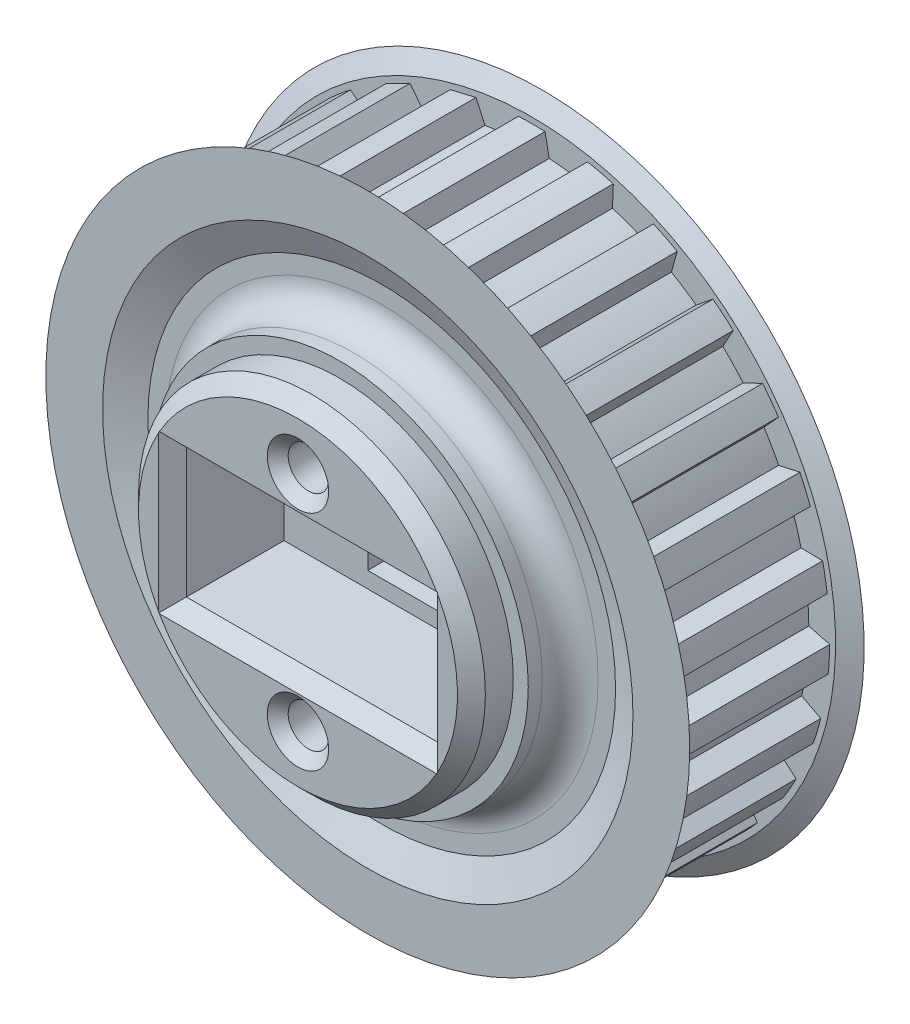
from build123d import *
from OCP.BRepFilletAPI import BRepFilletAPI_MakeChamfer
from build123d.topology import SkipClean

# Parameters (mm, degrees)
CROQUIS1_R                 = 1.5
SALIENTE_EXTRUIR1_DEPTH    = 11
CROQUIS2_R                 = 23.5
CROQUIS2_R_2               = 1.5
SALIENTE_EXTRUIR2_DEPTH    = 0.75
SALIENTE_EXTRUIR4_START    = 5.5
CROQUIS4_R                 = 12.35
CROQUIS4_R_2               = 1.5
SALIENTE_EXTRUIR4_DEPTH    = 5.5
SALIENTE_EXTRUIR6_START    = 0.75
CROQUIS6_R                 = 23.5
CROQUIS6_R_2               = 1.5
SALIENTE_EXTRUIR6_DEPTH    = 0.75
SKETCH6_R                  = 18.5
SKETCH6_R_2                = 12.35
CUT_EXTRUDE3_DEPTH         = 1
SALIENTE_EXTRUIR5_START    = 2.75
CROQUIS5_R                 = 13.5
CROQUIS5_R_2               = 1.5
SALIENTE_EXTRUIR5_DEPTH    = 2.75
CHAFL_N2_SIZE              = 1.732050808
CHAFL_N2_SIZE_2            = 1
CROQUIS3_R                 = 12.425
CROQUIS3_R_2               = 1.5
SALIENTE_EXTRUIR7_DEPTH    = 5
CUT_EXTRUDE4_START         = -1
SKETCH7_R                  = 19
SKETCH7_R_2                = 12.425
CUT_EXTRUDE4_DEPTH         = 1
CHAFL_N4_SIZE              = 1
CROQUIS7_R                 = 13.5
CROQUIS7_R_2               = 1.5
SALIENTE_EXTRUIR8_DEPTH    = 3
CORTAR_EXTRUIR1_DEPTH      = 37.670619111
CORTAR_EXTRUIR1_DEPTH_BACK = 37.670619111
CROQUIS8_R                 = 1.45
CROQUIS8_W                 = 6
CROQUIS8_H                 = 7
CROQUIS10_W                = 18
CROQUIS10_H                = 9.3
CORTAR_EXTRUIR3_DEPTH      = 8
CHAFL_N5_SIZE              = 1
SKETCH1_R                  = 12.35
SKETCH1_R_2                = 1.45
BOSS_EXTRUDE1_DEPTH        = 5
SKETCH2_R                  = 1.45
CUT_EXTRUDE1_DEPTH         = 40.487141021
SKETCH4_W                  = 6
SKETCH4_H                  = 7
CUT_EXTRUDE2_DEPTH         = 30
CHAMFER3_SIZE              = 1.25
CHAMFER2_SIZE              = 0.75
CHAMFER4_SIZE              = 1
CHAMFER4_SIZE_2            = 2.246036774
CHAMFER5_SIZE              = 0.75
FILLET1_R                  = 2
CHAMFER6_SIZE              = 1.2


# Some blends are built 0.0001 mm under size
with BuildPart() as part:
    # Croquis1 → Saliente-Extruir1 (new body)
    with BuildSketch(Plane.XY):
        with BuildLine():
            Line((-0.95, 21.328853696), (-1.25, 19.810603222))
            ThreePointArc((-1.25, 19.810603222), (-2.304444345, 19.715781401), (-3.352333424, 19.564875686))
            Line((-3.352333424, 19.564875686), (-3.99437954, 20.973016762))
            Line((-3.99437954, 20.973016762), (-5.843164794, 20.534846607))
            Line((-5.843164794, 20.534846607), (-5.7849456, 18.988336009))
            ThreePointArc((-5.7849456, 18.988336009), (-6.789099845, 18.652898523), (-7.773941685, 18.264400638))
            Line((-7.773941685, 18.264400638), (-8.723421045, 19.486519065))
            Line((-8.723421045, 19.486519065), (-10.421323062, 18.633800623))
            Line((-10.421323062, 18.633800623), (-10.008023285, 17.142402688))
            ThreePointArc((-10.008023285, 17.142402688), (-10.907753215, 16.584433057), (-11.776454737, 15.979287025))
            Line((-11.776454737, 15.979287025), (-12.982180664, 16.949498081))
            ThreePointArc((-12.982180664, 16.949498081), (-13.723515467, 16.355048861), (-14.437665106, 15.728201623))
            Line((-14.437665106, 15.728201623), (-13.691565845, 14.372318001))
            ThreePointArc((-13.691565845, 14.372318001), (-14.438366785, 13.621896512), (-15.144096067, 12.832725911))
            Line((-15.144096067, 12.832725911), (-16.541067563, 13.498725269))
            ThreePointArc((-16.541067563, 13.498725269), (-17.125330165, 12.749335933), (-17.675668887, 11.974691203))
            Line((-17.675668887, 11.974691203), (-16.636992546, 10.82741793))
            ThreePointArc((-16.636992546, 10.82741793), (-17.190604265, 9.925), (-17.695315257, 8.994349223))
            Line((-17.695315257, 8.994349223), (-19.208221228, 9.320232683))
            ThreePointArc((-19.208221228, 9.320232683), (-19.603913882, 8.456303005), (-19.960772783, 7.57562208))
            Line((-19.960772783, 7.57562208), (-18.685514673, 6.698808955))
            ThreePointArc((-18.685514673, 6.698808955), (-19.016091819, 5.693044169), (-19.292575422, 4.671084839))
            Line((-19.292575422, 4.671084839), (-20.839854714, 4.639283941))
            ThreePointArc((-20.839854714, 4.639283941), (-21.025645527, 3.707388593), (-21.169786252, 2.768149211))
            Line((-21.169786252, 2.768149211), (-19.726695866, 2.209065457))
            ThreePointArc((-19.726695866, 2.209065457), (-19.816416942, 1.154174854), (-19.849767852, 0.096001063))
            Line((-19.849767852, 0.096001063), (-21.348006239, -0.291769799))
            ThreePointArc((-21.348006239, -0.291769799), (-21.313879179, -1.241392097), (-21.237531064, -2.188555299))
            Line((-21.237531064, -2.188555299), (-19.70440578, -2.399769333))
            ThreePointArc((-19.70440578, -2.399769333), (-19.548433897, -3.446916327), (-19.33685416, -4.484258155))
            Line((-19.33685416, -4.484258155), (-20.705281222, -5.207094153))
            ThreePointArc((-20.705281222, -5.207094153), (-20.453076088, -6.123249018), (-20.16035508, -7.027274227))
            Line((-20.16035508, -7.027274227), (-18.619846078, -6.879231936))
            ThreePointArc((-18.619846078, -6.879231936), (-18.226589722, -7.862183356), (-17.781485654, -8.822769856))
            Line((-17.781485654, -8.822769856), (-18.946329135, -9.841702715))
            ThreePointArc((-18.946329135, -9.841702715), (-18.489642371, -10.675), (-17.996329135, -11.487150982))
            Line((-17.996329135, -11.487150982), (-16.531485654, -10.987833365))
            ThreePointArc((-16.531485654, -10.987833365), (-15.922145376, -11.853598045), (-15.267512654, -12.68564375))
            Line((-15.267512654, -12.68564375), (-16.16597554, -13.945742535))
            ThreePointArc((-16.16597554, -13.945742535), (-15.529427248, -14.651258968), (-14.862116428, -15.327752454))
            Line((-14.862116428, -15.327752454), (-13.55190856, -14.504077854))
            ThreePointArc((-13.55190856, -14.504077854), (-12.759334052, -15.205982196), (-11.930464095, -15.864631306))
            Line((-11.930464095, -15.864631306), (-12.514110019, -17.297963766))
            ThreePointArc((-12.514110019, -17.297963766), (-11.732016682, -17.837664774), (-10.926683177, -18.342030824))
            Line((-10.926683177, -18.342030824), (-9.841744567, -17.238403751))
            ThreePointArc((-9.841744567, -17.238403751), (-8.908663727, -17.73860791), (-7.950241129, -18.188352481))
            Line((-7.950241129, -18.188352481), (-8.187605588, -19.717647292))
            ThreePointArc((-8.187605588, -19.717647292), (-7.30213006, -20.062437454), (-6.402189608, -20.367485564))
            Line((-6.402189608, -20.367485564), (-5.601009577, -19.04340284))
            ThreePointArc((-5.601009577, -19.04340284), (-4.577725034, -19.314940681), (-3.541418606, -19.531534867))
            Line((-3.541418606, -19.531534867), (-3.41970522, -21.074347349))
            ThreePointArc((-3.41970522, -21.074347349), (-2.478583717, -21.205638938), (-1.532552341, -21.294923886))
            Line((-1.532552341, -21.294923886), (-1.058322711, -19.821767152))
            ThreePointArc((-1.058322711, -19.821767152), (0, -19.85), (1.058322711, -19.821767152))
            Line((1.058322711, -19.821767152), (1.532552341, -21.294923886))
            ThreePointArc((1.532552341, -21.294923886), (2.478583717, -21.205638938), (3.41970522, -21.074347349))
            Line((3.41970522, -21.074347349), (3.541418606, -19.531534867))
            ThreePointArc((3.541418606, -19.531534867), (4.577725034, -19.314940681), (5.601009577, -19.04340284))
            Line((5.601009577, -19.04340284), (6.402189608, -20.367485564))
            ThreePointArc((6.402189608, -20.367485564), (7.30213006, -20.062437454), (8.187605588, -19.717647292))
            Line((8.187605588, -19.717647292), (7.950241129, -18.188352481))
            ThreePointArc((7.950241129, -18.188352481), (8.908663727, -17.73860791), (9.841744567, -17.238403751))
            Line((9.841744567, -17.238403751), (10.926683177, -18.342030824))
            ThreePointArc((10.926683177, -18.342030824), (11.732016682, -17.837664774), (12.514110019, -17.297963766))
            Line((12.514110019, -17.297963766), (11.930464095, -15.864631306))
            ThreePointArc((11.930464095, -15.864631306), (12.759334052, -15.205982196), (13.55190856, -14.504077854))
            Line((13.55190856, -14.504077854), (14.862116428, -15.327752454))
            ThreePointArc((14.862116428, -15.327752454), (15.529427248, -14.651258968), (16.16597554, -13.945742535))
            Line((16.16597554, -13.945742535), (15.267512654, -12.68564375))
            ThreePointArc((15.267512654, -12.68564375), (15.922145376, -11.853598045), (16.531485654, -10.987833365))
            Line((16.531485654, -10.987833365), (17.996329135, -11.487150982))
            ThreePointArc((17.996329135, -11.487150982), (18.489642371, -10.675), (18.946329135, -9.841702715))
            Line((18.946329135, -9.841702715), (17.781485654, -8.822769856))
            ThreePointArc((17.781485654, -8.822769856), (18.226589722, -7.862183356), (18.619846078, -6.879231936))
            Line((18.619846078, -6.879231936), (20.16035508, -7.027274227))
            ThreePointArc((20.16035508, -7.027274227), (20.453076088, -6.123249018), (20.705281222, -5.207094153))
            Line((20.705281222, -5.207094153), (19.33685416, -4.484258155))
            ThreePointArc((19.33685416, -4.484258155), (19.548433897, -3.446916327), (19.70440578, -2.399769333))
            Line((19.70440578, -2.399769333), (21.237531064, -2.188555299))
            ThreePointArc((21.237531064, -2.188555299), (21.313879179, -1.241392097), (21.348006239, -0.291769799))
            Line((21.348006239, -0.291769799), (19.849767852, 0.096001063))
            ThreePointArc((19.849767852, 0.096001063), (19.816416942, 1.154174854), (19.726695866, 2.209065457))
            Line((19.726695866, 2.209065457), (21.169786252, 2.768149211))
            ThreePointArc((21.169786252, 2.768149211), (21.025645527, 3.707388593), (20.839854714, 4.639283941))
            Line((20.839854714, 4.639283941), (19.292575422, 4.671084839))
            ThreePointArc((19.292575422, 4.671084839), (19.016091819, 5.693044169), (18.685514673, 6.698808955))
            Line((18.685514673, 6.698808955), (19.960772783, 7.57562208))
            ThreePointArc((19.960772783, 7.57562208), (19.603913882, 8.456303005), (19.208221228, 9.320232683))
            Line((19.208221228, 9.320232683), (17.695315257, 8.994349223))
            ThreePointArc((17.695315257, 8.994349223), (17.190604265, 9.925), (16.636992546, 10.82741793))
            Line((16.636992546, 10.82741793), (17.675668887, 11.974691203))
            ThreePointArc((17.675668887, 11.974691203), (17.125330165, 12.749335933), (16.541067563, 13.498725269))
            Line((16.541067563, 13.498725269), (15.144096067, 12.832725911))
            ThreePointArc((15.144096067, 12.832725911), (14.438366785, 13.621896512), (13.691565845, 14.372318001))
            Line((13.691565845, 14.372318001), (14.437665106, 15.728201623))
            ThreePointArc((14.437665106, 15.728201623), (13.723515467, 16.355048861), (12.982180664, 16.949498081))
            Line((12.982180664, 16.949498081), (11.776454737, 15.979287025))
            ThreePointArc((11.776454737, 15.979287025), (10.907753215, 16.584433057), (10.008023285, 17.142402688))
            Line((10.008023285, 17.142402688), (10.421323062, 18.633800623))
            ThreePointArc((10.421323062, 18.633800623), (9.581862497, 19.079056871), (8.723421045, 19.486519065))
            Line((8.723421045, 19.486519065), (7.773941685, 18.264400638))
            ThreePointArc((7.773941685, 18.264400638), (6.789099845, 18.652898523), (5.7849456, 18.988336009))
            Line((5.7849456, 18.988336009), (5.843164794, 20.534846607))
            ThreePointArc((5.843164794, 20.534846607), (4.92364884, 20.774507987), (3.99437954, 20.973016762))
            Line((3.99437954, 20.973016762), (3.352333424, 19.564875686))
            ThreePointArc((3.352333424, 19.564875686), (2.304444345, 19.715781401), (1.25, 19.810603222))
            Line((1.25, 19.810603222), (0.95, 21.328853696))
            ThreePointArc((0.95, 21.328853696), (0, 21.35), (-0.95, 21.328853696))
        make_face()
        Circle(CROQUIS1_R, mode=Mode.SUBTRACT)
    extrude(amount=SALIENTE_EXTRUIR1_DEPTH)

    # Croquis2 → Saliente-Extruir2 (add)
    with BuildSketch(Plane.XY.offset(11)):
        Circle(CROQUIS2_R)
        Circle(CROQUIS2_R_2, mode=Mode.SUBTRACT)
    extrude(amount=SALIENTE_EXTRUIR2_DEPTH)

    # Croquis4 → Saliente-Extruir4 (add)
    with BuildSketch(Plane(origin=(0, 0, 0), x_dir=(-1, 0, 0), z_dir=(0, 0, -1)).offset(SALIENTE_EXTRUIR4_START)):
        with Locations(Location((0, 0, 0), (0, 0, 180))):
            Circle(CROQUIS4_R)
        Circle(CROQUIS4_R_2, mode=Mode.SUBTRACT)
    extrude(amount=-SALIENTE_EXTRUIR4_DEPTH)

    # Croquis6 → Saliente-Extruir6 (add)
    with SkipClean():  # the faces are left unmerged after this step: merging them gives an invalid solid
        with BuildSketch(Plane(origin=(0, 0, 0), x_dir=(-1, 0, 0), z_dir=(0, 0, -1)).offset(SALIENTE_EXTRUIR6_START)):
            with Locations(Location((0, 0, 0), (0, 0, 180))):
                Circle(CROQUIS6_R)
            Circle(CROQUIS6_R_2, mode=Mode.SUBTRACT)
        extrude(amount=-SALIENTE_EXTRUIR6_DEPTH)

    # Sketch6 → Cut-Extrude3 (cut)
    with SkipClean():  # the faces are left unmerged after this step: merging them gives an invalid solid
        with BuildSketch(Plane(origin=(0, 0, -0.75), x_dir=(-1, 0, 0), z_dir=(0, 0, -1))):
            Circle(SKETCH6_R)
            Circle(SKETCH6_R_2, mode=Mode.SUBTRACT)
        extrude(amount=-CUT_EXTRUDE3_DEPTH, mode=Mode.SUBTRACT)

    # Croquis5 → Saliente-Extruir5 (add)
    with BuildSketch(Plane(origin=(0, 0, 0.25), x_dir=(-1, 0, 0), z_dir=(0, 0, -1)).offset(SALIENTE_EXTRUIR5_START)):
        Circle(CROQUIS5_R)
        Circle(CROQUIS5_R_2, mode=Mode.SUBTRACT)
    extrude(amount=-SALIENTE_EXTRUIR5_DEPTH)

    # Chaflán2
    # the kernel refuses this chamfer: 1.732050808, 1 mm, written as the material it takes off along each edge
    with BuildSketch(Plane(origin=(0, 0, 0), x_dir=(1, 0, 0), z_dir=(0, 1, 0))) as chafl_n2_piece_1:
        Polygon((23.5 - CHAFL_N2_SIZE, 0), (23.5, CHAFL_N2_SIZE_2), (23.5, 0), align=None)
    revolve(axis=Axis((0, 0, 0), (0, 0, -1)), mode=Mode.SUBTRACT)
    with BuildSketch(Plane(origin=(0, 0, 11), x_dir=(1, 0, 0), z_dir=(0, -1, 0))) as chafl_n2_piece_2:
        Polygon((23.5 - CHAFL_N2_SIZE, 0), (23.5, CHAFL_N2_SIZE_2), (23.5, 0), align=None)
    revolve(axis=Axis((0, 0, 11), (0, 0, 1)), mode=Mode.SUBTRACT)

    # Croquis3 → Saliente-Extruir7 (add)
    with BuildSketch(Plane.XY.offset(11.75)):
        Circle(CROQUIS3_R)
        with Locations(Location((0, 0, 0), (0, 0, 180))):
            Circle(CROQUIS3_R_2, mode=Mode.SUBTRACT)
    extrude(amount=SALIENTE_EXTRUIR7_DEPTH)

    # Sketch7 → Cut-Extrude4 (cut)
    with BuildSketch(Plane.XY.offset(11.75).offset(CUT_EXTRUDE4_START)):
        Circle(SKETCH7_R)
        Circle(SKETCH7_R_2, mode=Mode.SUBTRACT)
    extrude(amount=CUT_EXTRUDE4_DEPTH, mode=Mode.SUBTRACT)

    # Chaflán4
    chafl_n4_edges = [part.edges().sort_by_distance(p)[0] for p in [
        (-12.425, 0, 16.75),
    ]]
    chamfer(chafl_n4_edges, length=CHAFL_N4_SIZE)

    # Croquis7 → Saliente-Extruir8 (add)
    with BuildSketch(Plane.XY.offset(10.75)):
        with Locations(Location((0, 0, 0), (0, 0, 180))):
            Circle(CROQUIS7_R)
        with Locations(Location((0, 0, 0), (0, 0, 180))):
            Circle(CROQUIS7_R_2, mode=Mode.SUBTRACT)
    extrude(amount=SALIENTE_EXTRUIR8_DEPTH)

    # Croquis8 → Cortar-Extruir1 (cut, two sides: drawn at the far end of the back side and taken through both)
    with BuildSketch(Plane.XY.offset(-CORTAR_EXTRUIR1_DEPTH_BACK)):
        with Locations((0, 8)):
            Circle(CROQUIS8_R)
        with Locations((0, -8)):
            Circle(CROQUIS8_R)
        Rectangle(CROQUIS8_W, CROQUIS8_H)
    extrude(amount=CORTAR_EXTRUIR1_DEPTH + CORTAR_EXTRUIR1_DEPTH_BACK, mode=Mode.SUBTRACT)

    # Croquis10 → Cortar-Extruir3 (cut)
    with BuildSketch(Plane.XY.offset(16.75)):
        Rectangle(CROQUIS10_W, CROQUIS10_H)
    extrude(amount=-CORTAR_EXTRUIR3_DEPTH, mode=Mode.SUBTRACT)

    # Chaflán5
    # the kernel refuses this chamfer: 1 mm, written as the material it takes off along each edge
    with BuildSketch(Plane(origin=(3, 3.5, -5.5), x_dir=(0.9996219169112968, 0, -0.027495876610586487), z_dir=(0, -1, 0)), Plane(origin=(-3, -3.5, -5.5), x_dir=(-0.9996219169112968, 0, -0.027495876610586487), z_dir=(0, 1, 0))) as chafl_n5_piece_1:
        Polygon((CHAFL_N5_SIZE * 0.999621916911, CHAFL_N5_SIZE * 0.0274958766106), (-CHAFL_N5_SIZE * 0.0274958766106, CHAFL_N5_SIZE * 0.999621916911), (0, 0), align=None)
    extrude(amount=7, mode=Mode.SUBTRACT)
    with BuildSketch(Plane(origin=(3, -3.5, -5.5), x_dir=(0, -0.9996219169112968, -0.027495876610586473), z_dir=(-1, 0, 0)), Plane(origin=(-3, 3.5, -5.5), x_dir=(0, 0.9996219169112968, -0.027495876610586487), z_dir=(1, 0, 0))) as chafl_n5_piece_2:
        Polygon((CHAFL_N5_SIZE * 0.999621916911, CHAFL_N5_SIZE * 0.0274958766106), (-CHAFL_N5_SIZE * 0.0274958766106, CHAFL_N5_SIZE * 0.999621916911), (0, 0), align=None)
    extrude(amount=6, mode=Mode.SUBTRACT)
    with BuildSketch(Plane(origin=(-9, 4.65, 16.75), x_dir=(-0.9996219169112968, 0, 0.027495876610585647), z_dir=(0, -1, 0)), Plane(origin=(9, -4.65, 16.75), x_dir=(0.9996219169112968, 0, 0.027495876610585647), z_dir=(0, 1, 0))) as chafl_n5_piece_3:
        Polygon((CHAFL_N5_SIZE * 0.999621916911, CHAFL_N5_SIZE * 0.0274958766106), (-CHAFL_N5_SIZE * 0.0274958766106, CHAFL_N5_SIZE * 0.999621916911), (0, 0), align=None)
    extrude(amount=9.3, mode=Mode.SUBTRACT)
    with BuildSketch(Plane(origin=(-9, -4.65, 16.75), x_dir=(0, -0.9996219169112968, 0.027495876610585623), z_dir=(1, 0, 0)), Plane(origin=(9, 4.65, 16.75), x_dir=(0, 0.9996219169112968, 0.027495876610585623), z_dir=(-1, 0, 0))) as chafl_n5_piece_4:
        Polygon((CHAFL_N5_SIZE * 0.999621916911, CHAFL_N5_SIZE * 0.0274958766106), (-CHAFL_N5_SIZE * 0.0274958766106, CHAFL_N5_SIZE * 0.999621916911), (0, 0), align=None)
    extrude(amount=18, mode=Mode.SUBTRACT)
    with BuildSketch(Plane(origin=(-3, 3.5, -5.5), x_dir=(0, 0.9996219169112968, -0.027495876610586487), z_dir=(1, 0, 0))) as chafl_n5_piece_5a_section:
        Polygon((CHAFL_N5_SIZE * 0.999621916911, CHAFL_N5_SIZE * 0.0274958766106), (-CHAFL_N5_SIZE * 0.0274958766106, CHAFL_N5_SIZE * 0.999621916911), (0, 0), align=None)
    chafl_n5_piece_5a = extrude(amount=8.571682988, mode=Mode.PRIVATE)
    chafl_n5_piece_5a = split(chafl_n5_piece_5a, bisect_by=Plane(origin=(3, 3.829793627, -5.170206373), z_dir=(1, 0, 0)), keep=Keep.TOP, mode=Mode.PRIVATE)
    with BuildSketch(Plane(origin=(3, 6.071682988, -5.5), x_dir=(0.9996219169112968, 0, -0.027495876610586487), z_dir=(0, -1, 0))) as chafl_n5_piece_5b_section:
        Polygon((CHAFL_N5_SIZE * 0.999621916911, CHAFL_N5_SIZE * 0.0274958766106), (-CHAFL_N5_SIZE * 0.0274958766106, CHAFL_N5_SIZE * 0.999621916911), (0, 0), align=None)
    chafl_n5_piece_5b = extrude(amount=9.571682988, mode=Mode.PRIVATE)
    chafl_n5_piece_5b = split(chafl_n5_piece_5b, bisect_by=Plane(origin=(3.329793627, 3.5, -5.170206373), z_dir=(0, 1, 0)), keep=Keep.TOP, mode=Mode.PRIVATE)
    chafl_n5_piece_5 = chafl_n5_piece_5a & chafl_n5_piece_5b
    add(chafl_n5_piece_5, mode=Mode.SUBTRACT)
    with BuildSketch(Plane(origin=(3, 3.5, -5.5), x_dir=(0.9996219169112968, 0, -0.027495876610586487), z_dir=(0, -1, 0))) as chafl_n5_piece_6a_section:
        Polygon((CHAFL_N5_SIZE * 0.999621916911, CHAFL_N5_SIZE * 0.0274958766106), (-CHAFL_N5_SIZE * 0.0274958766106, CHAFL_N5_SIZE * 0.999621916911), (0, 0), align=None)
    chafl_n5_piece_6a = extrude(amount=9.571682988, mode=Mode.PRIVATE)
    chafl_n5_piece_6a = split(chafl_n5_piece_6a, bisect_by=Plane(origin=(3.329793627, -3.5, -5.170206373), z_dir=(0, -1, 0)), keep=Keep.TOP, mode=Mode.PRIVATE)
    with BuildSketch(Plane(origin=(5.571682988, -3.5, -5.5), x_dir=(0, -0.9996219169112968, -0.027495876610586473), z_dir=(-1, 0, 0))) as chafl_n5_piece_6b_section:
        Polygon((CHAFL_N5_SIZE * 0.999621916911, CHAFL_N5_SIZE * 0.0274958766106), (-CHAFL_N5_SIZE * 0.0274958766106, CHAFL_N5_SIZE * 0.999621916911), (0, 0), align=None)
    chafl_n5_piece_6b = extrude(amount=8.571682988, mode=Mode.PRIVATE)
    chafl_n5_piece_6b = split(chafl_n5_piece_6b, bisect_by=Plane(origin=(3, -3.829793627, -5.170206373), z_dir=(1, 0, 0)), keep=Keep.TOP, mode=Mode.PRIVATE)
    chafl_n5_piece_6 = chafl_n5_piece_6a & chafl_n5_piece_6b
    add(chafl_n5_piece_6, mode=Mode.SUBTRACT)
    with BuildSketch(Plane(origin=(3, -3.5, -5.5), x_dir=(0, -0.9996219169112968, -0.027495876610586473), z_dir=(-1, 0, 0))) as chafl_n5_piece_7a_section:
        Polygon((CHAFL_N5_SIZE * 0.999621916911, CHAFL_N5_SIZE * 0.0274958766106), (-CHAFL_N5_SIZE * 0.0274958766106, CHAFL_N5_SIZE * 0.999621916911), (0, 0), align=None)
    chafl_n5_piece_7a = extrude(amount=8.571682988, mode=Mode.PRIVATE)
    chafl_n5_piece_7a = split(chafl_n5_piece_7a, bisect_by=Plane(origin=(-3, -3.829793627, -5.170206373), z_dir=(-1, 0, 0)), keep=Keep.TOP, mode=Mode.PRIVATE)
    with BuildSketch(Plane(origin=(-3, -6.071682988, -5.5), x_dir=(-0.9996219169112968, 0, -0.027495876610586487), z_dir=(0, 1, 0))) as chafl_n5_piece_7b_section:
        Polygon((CHAFL_N5_SIZE * 0.999621916911, CHAFL_N5_SIZE * 0.0274958766106), (-CHAFL_N5_SIZE * 0.0274958766106, CHAFL_N5_SIZE * 0.999621916911), (0, 0), align=None)
    chafl_n5_piece_7b = extrude(amount=9.571682988, mode=Mode.PRIVATE)
    chafl_n5_piece_7b = split(chafl_n5_piece_7b, bisect_by=Plane(origin=(-3.329793627, -3.5, -5.170206373), z_dir=(0, -1, 0)), keep=Keep.TOP, mode=Mode.PRIVATE)
    chafl_n5_piece_7 = chafl_n5_piece_7a & chafl_n5_piece_7b
    add(chafl_n5_piece_7, mode=Mode.SUBTRACT)
    with BuildSketch(Plane(origin=(-5.571682988, 3.5, -5.5), x_dir=(0, 0.9996219169112968, -0.027495876610586487), z_dir=(1, 0, 0))) as chafl_n5_piece_8a_section:
        Polygon((CHAFL_N5_SIZE * 0.999621916911, CHAFL_N5_SIZE * 0.0274958766106), (-CHAFL_N5_SIZE * 0.0274958766106, CHAFL_N5_SIZE * 0.999621916911), (0, 0), align=None)
    chafl_n5_piece_8a = extrude(amount=8.571682988, mode=Mode.PRIVATE)
    chafl_n5_piece_8a = split(chafl_n5_piece_8a, bisect_by=Plane(origin=(-3, 3.829793627, -5.170206373), z_dir=(-1, 0, 0)), keep=Keep.TOP, mode=Mode.PRIVATE)
    with BuildSketch(Plane(origin=(-3, -3.5, -5.5), x_dir=(-0.9996219169112968, 0, -0.027495876610586487), z_dir=(0, 1, 0))) as chafl_n5_piece_8b_section:
        Polygon((CHAFL_N5_SIZE * 0.999621916911, CHAFL_N5_SIZE * 0.0274958766106), (-CHAFL_N5_SIZE * 0.0274958766106, CHAFL_N5_SIZE * 0.999621916911), (0, 0), align=None)
    chafl_n5_piece_8b = extrude(amount=9.571682988, mode=Mode.PRIVATE)
    chafl_n5_piece_8b = split(chafl_n5_piece_8b, bisect_by=Plane(origin=(-3.329793627, 3.5, -5.170206373), z_dir=(0, 1, 0)), keep=Keep.TOP, mode=Mode.PRIVATE)
    chafl_n5_piece_8 = chafl_n5_piece_8a & chafl_n5_piece_8b
    add(chafl_n5_piece_8, mode=Mode.SUBTRACT)
    with BuildSketch(Plane(origin=(9, 4.65, 16.75), x_dir=(0, 0.9996219169112968, 0.027495876610585623), z_dir=(-1, 0, 0))) as chafl_n5_piece_9a_section:
        Polygon((CHAFL_N5_SIZE * 0.999621916911, CHAFL_N5_SIZE * 0.0274958766106), (-CHAFL_N5_SIZE * 0.0274958766106, CHAFL_N5_SIZE * 0.999621916911), (0, 0), align=None)
    chafl_n5_piece_9a = extrude(amount=20.571682988, mode=Mode.PRIVATE)
    chafl_n5_piece_9a = split(chafl_n5_piece_9a, bisect_by=Plane(origin=(-9, 4.979793627, 16.420206373), z_dir=(-1, 0, 0)), keep=Keep.TOP, mode=Mode.PRIVATE)
    with BuildSketch(Plane(origin=(-9, 7.221682988, 16.75), x_dir=(-0.9996219169112968, 0, 0.027495876610585647), z_dir=(0, -1, 0))) as chafl_n5_piece_9b_section:
        Polygon((CHAFL_N5_SIZE * 0.999621916911, CHAFL_N5_SIZE * 0.0274958766106), (-CHAFL_N5_SIZE * 0.0274958766106, CHAFL_N5_SIZE * 0.999621916911), (0, 0), align=None)
    chafl_n5_piece_9b = extrude(amount=11.871682988, mode=Mode.PRIVATE)
    chafl_n5_piece_9b = split(chafl_n5_piece_9b, bisect_by=Plane(origin=(-9.329793627, 4.65, 16.420206373), z_dir=(0, 1, 0)), keep=Keep.TOP, mode=Mode.PRIVATE)
    chafl_n5_piece_9 = chafl_n5_piece_9a & chafl_n5_piece_9b
    add(chafl_n5_piece_9, mode=Mode.SUBTRACT)
    with BuildSketch(Plane(origin=(-9, 4.65, 16.75), x_dir=(-0.9996219169112968, 0, 0.027495876610585647), z_dir=(0, -1, 0))) as chafl_n5_piece_10a_section:
        Polygon((CHAFL_N5_SIZE * 0.999621916911, CHAFL_N5_SIZE * 0.0274958766106), (-CHAFL_N5_SIZE * 0.0274958766106, CHAFL_N5_SIZE * 0.999621916911), (0, 0), align=None)
    chafl_n5_piece_10a = extrude(amount=11.871682988, mode=Mode.PRIVATE)
    chafl_n5_piece_10a = split(chafl_n5_piece_10a, bisect_by=Plane(origin=(-9.329793627, -4.65, 16.420206373), z_dir=(0, -1, 0)), keep=Keep.TOP, mode=Mode.PRIVATE)
    with BuildSketch(Plane(origin=(-11.571682988, -4.65, 16.75), x_dir=(0, -0.9996219169112968, 0.027495876610585623), z_dir=(1, 0, 0))) as chafl_n5_piece_10b_section:
        Polygon((CHAFL_N5_SIZE * 0.999621916911, CHAFL_N5_SIZE * 0.0274958766106), (-CHAFL_N5_SIZE * 0.0274958766106, CHAFL_N5_SIZE * 0.999621916911), (0, 0), align=None)
    chafl_n5_piece_10b = extrude(amount=20.571682988, mode=Mode.PRIVATE)
    chafl_n5_piece_10b = split(chafl_n5_piece_10b, bisect_by=Plane(origin=(-9, -4.979793627, 16.420206373), z_dir=(-1, 0, 0)), keep=Keep.TOP, mode=Mode.PRIVATE)
    chafl_n5_piece_10 = chafl_n5_piece_10a & chafl_n5_piece_10b
    add(chafl_n5_piece_10, mode=Mode.SUBTRACT)
    with BuildSketch(Plane(origin=(-9, -4.65, 16.75), x_dir=(0, -0.9996219169112968, 0.027495876610585623), z_dir=(1, 0, 0))) as chafl_n5_piece_11a_section:
        Polygon((CHAFL_N5_SIZE * 0.999621916911, CHAFL_N5_SIZE * 0.0274958766106), (-CHAFL_N5_SIZE * 0.0274958766106, CHAFL_N5_SIZE * 0.999621916911), (0, 0), align=None)
    chafl_n5_piece_11a = extrude(amount=20.571682988, mode=Mode.PRIVATE)
    chafl_n5_piece_11a = split(chafl_n5_piece_11a, bisect_by=Plane(origin=(9, -4.979793627, 16.420206373), z_dir=(1, 0, 0)), keep=Keep.TOP, mode=Mode.PRIVATE)
    with BuildSketch(Plane(origin=(9, -7.221682988, 16.75), x_dir=(0.9996219169112968, 0, 0.027495876610585647), z_dir=(0, 1, 0))) as chafl_n5_piece_11b_section:
        Polygon((CHAFL_N5_SIZE * 0.999621916911, CHAFL_N5_SIZE * 0.0274958766106), (-CHAFL_N5_SIZE * 0.0274958766106, CHAFL_N5_SIZE * 0.999621916911), (0, 0), align=None)
    chafl_n5_piece_11b = extrude(amount=11.871682988, mode=Mode.PRIVATE)
    chafl_n5_piece_11b = split(chafl_n5_piece_11b, bisect_by=Plane(origin=(9.329793627, -4.65, 16.420206373), z_dir=(0, -1, 0)), keep=Keep.TOP, mode=Mode.PRIVATE)
    chafl_n5_piece_11 = chafl_n5_piece_11a & chafl_n5_piece_11b
    add(chafl_n5_piece_11, mode=Mode.SUBTRACT)
    with BuildSketch(Plane(origin=(11.571682988, 4.65, 16.75), x_dir=(0, 0.9996219169112968, 0.027495876610585623), z_dir=(-1, 0, 0))) as chafl_n5_piece_12a_section:
        Polygon((CHAFL_N5_SIZE * 0.999621916911, CHAFL_N5_SIZE * 0.0274958766106), (-CHAFL_N5_SIZE * 0.0274958766106, CHAFL_N5_SIZE * 0.999621916911), (0, 0), align=None)
    chafl_n5_piece_12a = extrude(amount=20.571682988, mode=Mode.PRIVATE)
    chafl_n5_piece_12a = split(chafl_n5_piece_12a, bisect_by=Plane(origin=(9, 4.979793627, 16.420206373), z_dir=(1, 0, 0)), keep=Keep.TOP, mode=Mode.PRIVATE)
    with BuildSketch(Plane(origin=(9, -4.65, 16.75), x_dir=(0.9996219169112968, 0, 0.027495876610585647), z_dir=(0, 1, 0))) as chafl_n5_piece_12b_section:
        Polygon((CHAFL_N5_SIZE * 0.999621916911, CHAFL_N5_SIZE * 0.0274958766106), (-CHAFL_N5_SIZE * 0.0274958766106, CHAFL_N5_SIZE * 0.999621916911), (0, 0), align=None)
    chafl_n5_piece_12b = extrude(amount=11.871682988, mode=Mode.PRIVATE)
    chafl_n5_piece_12b = split(chafl_n5_piece_12b, bisect_by=Plane(origin=(9.329793627, 4.65, 16.420206373), z_dir=(0, 1, 0)), keep=Keep.TOP, mode=Mode.PRIVATE)
    chafl_n5_piece_12 = chafl_n5_piece_12a & chafl_n5_piece_12b
    add(chafl_n5_piece_12, mode=Mode.SUBTRACT)

    # Sketch1 → Boss-Extrude1 (add)
    with BuildSketch(Plane(origin=(0, 0, -5.5), x_dir=(-1, 0, 0), z_dir=(0, 0, -1))):
        Circle(SKETCH1_R)
        with Locations(Location((0, 8, 0), (0, 0, 180))):
            Circle(SKETCH1_R_2, mode=Mode.SUBTRACT)
        with Locations(Location((0, -8, 0), (0, 0, 180))):
            Circle(SKETCH1_R_2, mode=Mode.SUBTRACT)
    extrude(amount=-BOSS_EXTRUDE1_DEPTH)

    # Sketch2 → Cut-Extrude1 (cut, through all)
    with BuildSketch(Plane(origin=(0, 0, -5.5), x_dir=(-1, 0, 0), z_dir=(0, 0, -1))):
        with Locations((-6.5, 0)):
            Circle(SKETCH2_R)
        with Locations((6.5, 0)):
            Circle(SKETCH2_R)
    extrude(amount=-CUT_EXTRUDE1_DEPTH, mode=Mode.SUBTRACT)

    # Sketch4 → Cut-Extrude2 (cut)
    with BuildSketch(Plane.XY.offset(16.75)):
        Rectangle(SKETCH4_W, SKETCH4_H)
    extrude(amount=-CUT_EXTRUDE2_DEPTH, mode=Mode.SUBTRACT)

    # Chamfer3
    # the kernel refuses this chamfer: 1.25 mm, written as the material it takes off along each edge
    with BuildSketch(Plane(origin=(-3, -3.5, -5.5), x_dir=(0.027495876610586317, 0, 0.9996219169112968), z_dir=(0, 1, 0)), Plane(origin=(3, 3.5, -5.5), x_dir=(-0.027495876610586317, 0, 0.9996219169112968), z_dir=(0, -1, 0))) as chamfer3_piece_1:
        Polygon((CHAMFER3_SIZE * 0.999621916911, -CHAMFER3_SIZE * 0.0274958766106), (-CHAMFER3_SIZE * 0.0274958766106, -CHAMFER3_SIZE * 0.999621916911), (0, 0), align=None)
    extrude(amount=7, mode=Mode.SUBTRACT)
    with BuildSketch(Plane(origin=(-3, 3.5, -5.5), x_dir=(0, -0.027495876610586317, 0.9996219169112968), z_dir=(1, 0, 0)), Plane(origin=(3, -3.5, -5.5), x_dir=(0, 0.027495876610586317, 0.9996219169112968), z_dir=(-1, 0, 0))) as chamfer3_piece_2:
        Polygon((CHAMFER3_SIZE * 0.999621916911, -CHAMFER3_SIZE * 0.0274958766106), (-CHAMFER3_SIZE * 0.0274958766106, -CHAMFER3_SIZE * 0.999621916911), (0, 0), align=None)
    extrude(amount=6, mode=Mode.SUBTRACT)
    with BuildSketch(Plane(origin=(-3, -6.714603735, -5.5), x_dir=(0.027495876610586317, 0, 0.9996219169112968), z_dir=(0, 1, 0))) as chamfer3_piece_3a_section:
        Polygon((CHAMFER3_SIZE * 0.999621916911, -CHAMFER3_SIZE * 0.0274958766106), (-CHAMFER3_SIZE * 0.0274958766106, -CHAMFER3_SIZE * 0.999621916911), (0, 0), align=None)
    chamfer3_piece_3a = extrude(amount=10.214603735, mode=Mode.PRIVATE)
    chamfer3_piece_3a = split(chamfer3_piece_3a, bisect_by=Plane(origin=(-3.412242034, -3.5, -5.087757966), z_dir=(0, -1, 0)), keep=Keep.TOP, mode=Mode.PRIVATE)
    with BuildSketch(Plane(origin=(3, -3.5, -5.5), x_dir=(0, 0.027495876610586317, 0.9996219169112968), z_dir=(-1, 0, 0))) as chamfer3_piece_3b_section:
        Polygon((CHAMFER3_SIZE * 0.999621916911, -CHAMFER3_SIZE * 0.0274958766106), (-CHAMFER3_SIZE * 0.0274958766106, -CHAMFER3_SIZE * 0.999621916911), (0, 0), align=None)
    chamfer3_piece_3b = extrude(amount=9.214603735, mode=Mode.PRIVATE)
    chamfer3_piece_3b = split(chamfer3_piece_3b, bisect_by=Plane(origin=(-3, -3.912242034, -5.087757966), z_dir=(-1, 0, 0)), keep=Keep.TOP, mode=Mode.PRIVATE)
    chamfer3_piece_3 = chamfer3_piece_3a & chamfer3_piece_3b
    add(chamfer3_piece_3, mode=Mode.SUBTRACT)
    with BuildSketch(Plane(origin=(-3, -3.5, -5.5), x_dir=(0.027495876610586317, 0, 0.9996219169112968), z_dir=(0, 1, 0))) as chamfer3_piece_4a_section:
        Polygon((CHAMFER3_SIZE * 0.999621916911, -CHAMFER3_SIZE * 0.0274958766106), (-CHAMFER3_SIZE * 0.0274958766106, -CHAMFER3_SIZE * 0.999621916911), (0, 0), align=None)
    chamfer3_piece_4a = extrude(amount=10.214603735, mode=Mode.PRIVATE)
    chamfer3_piece_4a = split(chamfer3_piece_4a, bisect_by=Plane(origin=(-3.412242034, 3.5, -5.087757966), z_dir=(0, 1, 0)), keep=Keep.TOP, mode=Mode.PRIVATE)
    with BuildSketch(Plane(origin=(-6.214603735, 3.5, -5.5), x_dir=(0, -0.027495876610586317, 0.9996219169112968), z_dir=(1, 0, 0))) as chamfer3_piece_4b_section:
        Polygon((CHAMFER3_SIZE * 0.999621916911, -CHAMFER3_SIZE * 0.0274958766106), (-CHAMFER3_SIZE * 0.0274958766106, -CHAMFER3_SIZE * 0.999621916911), (0, 0), align=None)
    chamfer3_piece_4b = extrude(amount=9.214603735, mode=Mode.PRIVATE)
    chamfer3_piece_4b = split(chamfer3_piece_4b, bisect_by=Plane(origin=(-3, 3.912242034, -5.087757966), z_dir=(-1, 0, 0)), keep=Keep.TOP, mode=Mode.PRIVATE)
    chamfer3_piece_4 = chamfer3_piece_4a & chamfer3_piece_4b
    add(chamfer3_piece_4, mode=Mode.SUBTRACT)
    with BuildSketch(Plane(origin=(-3, 3.5, -5.5), x_dir=(0, -0.027495876610586317, 0.9996219169112968), z_dir=(1, 0, 0))) as chamfer3_piece_5a_section:
        Polygon((CHAMFER3_SIZE * 0.999621916911, -CHAMFER3_SIZE * 0.0274958766106), (-CHAMFER3_SIZE * 0.0274958766106, -CHAMFER3_SIZE * 0.999621916911), (0, 0), align=None)
    chamfer3_piece_5a = extrude(amount=9.214603735, mode=Mode.PRIVATE)
    chamfer3_piece_5a = split(chamfer3_piece_5a, bisect_by=Plane(origin=(3, 3.912242034, -5.087757966), z_dir=(1, 0, 0)), keep=Keep.TOP, mode=Mode.PRIVATE)
    with BuildSketch(Plane(origin=(3, 6.714603735, -5.5), x_dir=(-0.027495876610586317, 0, 0.9996219169112968), z_dir=(0, -1, 0))) as chamfer3_piece_5b_section:
        Polygon((CHAMFER3_SIZE * 0.999621916911, -CHAMFER3_SIZE * 0.0274958766106), (-CHAMFER3_SIZE * 0.0274958766106, -CHAMFER3_SIZE * 0.999621916911), (0, 0), align=None)
    chamfer3_piece_5b = extrude(amount=10.214603735, mode=Mode.PRIVATE)
    chamfer3_piece_5b = split(chamfer3_piece_5b, bisect_by=Plane(origin=(3.412242034, 3.5, -5.087757966), z_dir=(0, 1, 0)), keep=Keep.TOP, mode=Mode.PRIVATE)
    chamfer3_piece_5 = chamfer3_piece_5a & chamfer3_piece_5b
    add(chamfer3_piece_5, mode=Mode.SUBTRACT)
    with BuildSketch(Plane(origin=(6.214603735, -3.5, -5.5), x_dir=(0, 0.027495876610586317, 0.9996219169112968), z_dir=(-1, 0, 0))) as chamfer3_piece_6a_section:
        Polygon((CHAMFER3_SIZE * 0.999621916911, -CHAMFER3_SIZE * 0.0274958766106), (-CHAMFER3_SIZE * 0.0274958766106, -CHAMFER3_SIZE * 0.999621916911), (0, 0), align=None)
    chamfer3_piece_6a = extrude(amount=9.214603735, mode=Mode.PRIVATE)
    chamfer3_piece_6a = split(chamfer3_piece_6a, bisect_by=Plane(origin=(3, -3.912242034, -5.087757966), z_dir=(1, 0, 0)), keep=Keep.TOP, mode=Mode.PRIVATE)
    with BuildSketch(Plane(origin=(3, 3.5, -5.5), x_dir=(-0.027495876610586317, 0, 0.9996219169112968), z_dir=(0, -1, 0))) as chamfer3_piece_6b_section:
        Polygon((CHAMFER3_SIZE * 0.999621916911, -CHAMFER3_SIZE * 0.0274958766106), (-CHAMFER3_SIZE * 0.0274958766106, -CHAMFER3_SIZE * 0.999621916911), (0, 0), align=None)
    chamfer3_piece_6b = extrude(amount=10.214603735, mode=Mode.PRIVATE)
    chamfer3_piece_6b = split(chamfer3_piece_6b, bisect_by=Plane(origin=(3.412242034, -3.5, -5.087757966), z_dir=(0, -1, 0)), keep=Keep.TOP, mode=Mode.PRIVATE)
    chamfer3_piece_6 = chamfer3_piece_6a & chamfer3_piece_6b
    add(chamfer3_piece_6, mode=Mode.SUBTRACT)

    # Chamfer2
    chamfer2_edges = [part.edges().sort_by_distance(p)[0] for p in [
        (0, -12.35, -5.5),
    ]]
    chamfer(chamfer2_edges, length=CHAMFER2_SIZE)

    # Chamfer4
    chamfer4_edges_1 = [part.edges().sort_by_distance(p)[0] for p in [
        (18.5, 0, 0.25),
    ]]
    chamfer4_side_1 = [part.faces().sort_by_distance(p)[0] for p in [
        (18.5, 0, 0.23),
    ]]
    chamfer4_edges_2 = [part.edges().sort_by_distance(p)[0] for p in [
        (-19, 0, 10.75),
    ]]
    chamfer4_side_2 = [part.faces().sort_by_distance(p)[0] for p in [
        (-18.98, 0, 10.75),
    ]]
    chamfer4 = BRepFilletAPI_MakeChamfer(part.part.solid().wrapped)
    for e in chamfer4_edges_1:
        chamfer4.Add(CHAMFER4_SIZE - 0.0001, CHAMFER4_SIZE_2 - 0.0001, e.wrapped, chamfer4_side_1[0].wrapped)
    for e in chamfer4_edges_2:
        chamfer4.Add(CHAMFER4_SIZE_2 - 0.0001, CHAMFER4_SIZE - 0.0001, e.wrapped, chamfer4_side_2[0].wrapped)
    add(Compound.cast(chamfer4.Shape()), mode=Mode.REPLACE)  # a hair under: the kernel refuses the full size

    # Chamfer5
    chamfer5_edges = [part.edges().sort_by_distance(p)[0] for p in [
        (-1.45, -8, 16.75),
        (-1.45, 8, 16.75),
        (7.95, 0, 8.75),
        (-5.05, 0, 8.75),
    ]]
    chamfer(chamfer5_edges, length=CHAMFER5_SIZE)

    # Fillet1
    fillet1_edges = [part.edges().sort_by_distance(p)[0] for p in [
        (13.5, 0, 0.25),
        (13.5, 0, 10.75),
    ]]
    fillet(fillet1_edges, radius=FILLET1_R)

    # Chamfer6
    # the kernel refuses this chamfer: 1.2 mm, written as the material it takes off along each edge
    with BuildSketch(Plane(origin=(0, -8, -5.5), x_dir=(1, 0, 0), z_dir=(0, -1, 0))) as chamfer6_piece_1:
        Polygon((1.45, CHAMFER6_SIZE), (1.45 + CHAMFER6_SIZE, 0), (1.45, 0), align=None)
    revolve(axis=Axis((0, -8, -5.5), (0, 0, 1)), mode=Mode.SUBTRACT)
    with BuildSketch(Plane(origin=(0, 8, -5.5), x_dir=(1, 0, 0), z_dir=(0, -1, 0))) as chamfer6_piece_2:
        Polygon((1.45, CHAMFER6_SIZE), (1.45 + CHAMFER6_SIZE, 0), (1.45, 0), align=None)
    revolve(axis=Axis((0, 8, -5.5), (0, 0, 1)), mode=Mode.SUBTRACT)
    with BuildSketch(Plane(origin=(6.5, 0, -5.5), x_dir=(-1, 0, 0), z_dir=(0, -1, 0))) as chamfer6_piece_3:
        Polygon((1.45 + CHAMFER6_SIZE, 0), (1.45, -CHAMFER6_SIZE), (1.45, 0), align=None)
    revolve(axis=Axis((6.5, 0, -5.5), (0, 0, -1)), mode=Mode.SUBTRACT)
    with BuildSketch(Plane(origin=(-6.5, 0, -5.5), x_dir=(-1, 0, 0), z_dir=(0, -1, 0))) as chamfer6_piece_4:
        Polygon((1.45 + CHAMFER6_SIZE, 0), (1.45, -CHAMFER6_SIZE), (1.45, 0), align=None)
    revolve(axis=Axis((-6.5, 0, -5.5), (0, 0, -1)), mode=Mode.SUBTRACT)


solid = part.part
